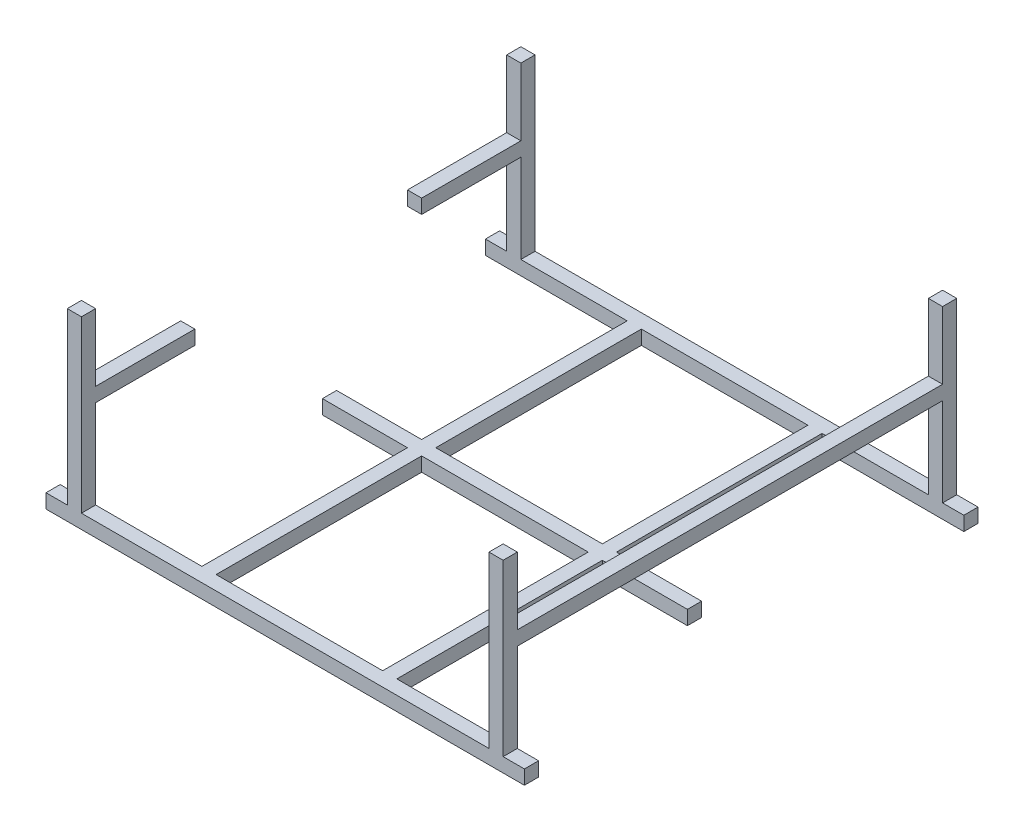
from build123d import *

# Parameters (mm, degrees)
SKETCH_1_W         = 235
SKETCH_1_H         = 600
EXTRUDE_1_DEPTH    = 20
EXTRUDE_4_DEPTH    = 20
SKETCH_6_W         = 640
SKETCH_6_H         = 20
EXTRUDE_6_DEPTH    = 20
SKETCH1_W          = 320
SKETCH1_H          = 20
CUT_EXTRUDE1_DEPTH = 20
SKETCH2_W          = 515
SKETCH2_H          = 20
EXTRUDE1_DEPTH     = 20


with BuildPart() as part:
    # 草图1 → 凸台-拉伸1 (new body)
    with BuildSketch(Plane(origin=(0, 0, 0), x_dir=(1, 0, 0), z_dir=(0, 1, 0))):
        Polygon((-221.510078765, -7.502951786), (-21.510078765, -7.502951786), (-21.510078765, 592.497048214), (-221.510078765, 592.497048214), (-221.510078765, 612.497048214), (453.489921235, 612.497048214), (453.489921235, 592.497048214), (253.489921235, 592.497048214), (253.489921235, -7.502951786), (453.489921235, -7.502951786), (453.489921235, -27.502951786), (-221.510078765, -27.502951786), align=None)
        with Locations((115.989921235, 292.497048214)):
            Rectangle(SKETCH_1_W, SKETCH_1_H, mode=Mode.SUBTRACT)
    extrude(amount=EXTRUDE_1_DEPTH)

    # 草图2 → 凸台-拉伸4 (add)
    with BuildSketch(Plane.ZY.offset(191.510078765)):
        Polygon((27.502951786, 20), (7.502951786, 20), (7.502951786, 165), (7.502951786, 260), (27.502951786, 260), align=None)
        Polygon((-592.497048214, 260), (-592.497048214, 165), (-592.497048214, 20), (-612.497048214, 20), (-612.497048214, 260), align=None)
    extrude_4 = extrude(amount=-EXTRUDE_4_DEPTH)

    # 镜向3: 凸台-拉伸4 across plane
    add(extrude_4.mirror(Plane(origin=(115.989921235, 0, 0), x_dir=(0, 0, 1), z_dir=(1, 0, 0))))

    # 草图6 → 凸台-拉伸6 (add)
    with BuildSketch(Plane.ZY.offset(191.510078765)):
        with Locations((-292.497048214, 155)):
            Rectangle(SKETCH_6_W, SKETCH_6_H)
    extrude_6 = extrude(amount=-EXTRUDE_6_DEPTH)

    # 镜向6: 凸台-拉伸6 across plane
    add(extrude_6.mirror(Plane(origin=(115.989921235, 0, 0), x_dir=(0, 0, 1), z_dir=(1, 0, 0))))

    # Sketch1 → Cut-Extrude1 (cut)
    with BuildSketch(Plane.ZY.offset(191.510078765)):
        with Locations((-292.497048214, 155)):
            Rectangle(SKETCH1_W, SKETCH1_H)
    extrude(amount=-CUT_EXTRUDE1_DEPTH, mode=Mode.SUBTRACT)

    # Sketch2 → Extrude1 (add)
    with BuildSketch(Plane(origin=(0, 0, 0), x_dir=(-1, 0, 0), z_dir=(0, -1, 0))):
        with Locations((-115.989921235, 292.497048214)):
            Rectangle(SKETCH2_W, SKETCH2_H)
    extrude(amount=-EXTRUDE1_DEPTH)


solid = part.part
